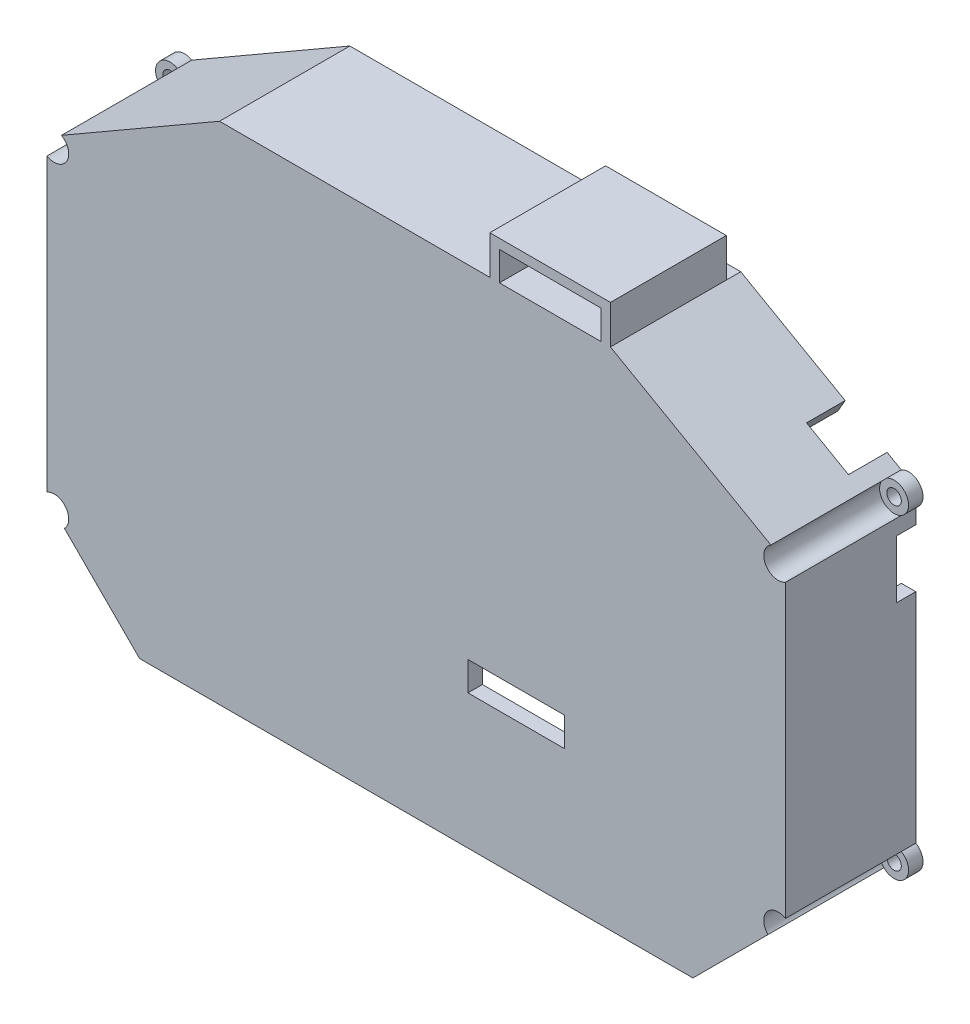
from build123d import *

# Parameters (mm, degrees)
SKETCH_2_R          = 1.5
EXTRUDE_1_DEPTH     = 27
SHELL_1_DEPTH       = 24
CUT_EXTRUDE_START   = -24
SKETCH_3_R          = 3
CUT_EXTRUDE_1_DEPTH = 24
SKETCH_5_W          = 20
SKETCH_5_H          = 6
CUT_EXTRUDE_3_DEPTH = 32
SKETCH_6_W          = 4
SKETCH_6_H          = 12
CUT_EXTRUDE_4_DEPTH = 32
SKETCH_7_W          = 10
SKETCH_7_H          = 8
CUT_EXTRUDE_5_DEPTH = 32
EXTRUDE_2_DEPTH     = 24
SKETCH_9_W          = 10
SKETCH_9_H          = 3
CUT_EXTRUDE_6_DEPTH = 24
SKETCH_10_R         = 1.35
CUT_EXTRUDE_7_DEPTH = 10
CUT_EXTRUDE_8_DEPTH = 10


# Read off the part's stored shape, not the designer's step: 抽壳1
with BuildPart() as part:
    # 草图2 → 凸台-拉伸1 (new body)
    with BuildSketch(Plane.XY):
        with BuildLine():
            Line((-76.5, 30.151923789), (-76.5, -30.151923789))
            ThreePointArc((-76.5, -30.151923789), (-77.380060021, -34.576284287), (-72.878679656, -34.871320344))
            Line((-72.878679656, -34.871320344), (-57.32, -50.43))
            Line((-57.32, -50.43), (57.32, -50.43))
            Line((57.32, -50.43), (72.878679656, -34.871320344))
            ThreePointArc((72.878679656, -34.871320344), (77.380060021, -34.576284287), (76.5, -30.151923789))
            Line((76.5, -30.151923789), (76.5, 30.151923789))
            ThreePointArc((76.5, 30.151923789), (77.593259199, 34.258312544), (73.483390382, 35.33841559))
            Line((73.483390382, 35.33841559), (40.238526366, 54.25))
            Line((40.238526366, 54.25), (-40.760907637, 54.25))
            Line((-40.760907637, 54.25), (-73.5, 35.348076211))
            ThreePointArc((-73.5, 35.348076211), (-77.598076211, 34.25), (-76.5, 30.151923789))
        make_face()
        with Locations((-75, 32.75)):
            Circle(SKETCH_2_R, mode=Mode.SUBTRACT)
        with Locations((75, 32.75)):
            Circle(SKETCH_2_R, mode=Mode.SUBTRACT)
        with Locations((75, -32.75)):
            Circle(SKETCH_2_R, mode=Mode.SUBTRACT)
        with Locations((-75, -32.75)):
            Circle(SKETCH_2_R, mode=Mode.SUBTRACT)
    extrude(amount=EXTRUDE_1_DEPTH)

    # 抽壳1 outline → 抽壳1 (cut)
    with BuildSketch(Plane.XY):
        with BuildLine():
            Line((-73.5, 28.507359313), (-73.5, -28.507359313))
            ThreePointArc((-73.5, -28.507359313), (-71.254879923, -30.255190266), (-70.506971411, -33.000387902))
            Line((-70.506971411, -33.000387902), (-56.077359313, -47.43))
            Line((-56.077359313, -47.43), (56.077359313, -47.43))
            Line((56.077359313, -47.43), (70.506971411, -33.000387902))
            ThreePointArc((70.506971411, -33.000387902), (71.254879923, -30.255190266), (73.5, -28.507359313))
            Line((73.5, -28.507359313), (73.5, 28.507359313))
            ThreePointArc((73.5, 28.507359313), (71.110106029, 30.48754008), (70.570593139, 33.543948905))
            Line((70.570593139, 33.543948905), (39.444948236, 51.25))
            Line((39.444948236, 51.25), (-39.95706006, 51.25))
            Line((-39.95706006, 51.25), (-70.575765386, 33.572282238))
            ThreePointArc((-70.575765386, 33.572282238), (-71.102885683, 30.5), (-73.5, 28.507359313))
        make_face()
    extrude(amount=SHELL_1_DEPTH, mode=Mode.SUBTRACT)

    # 草图3 → 切除-拉伸1 (cut)
    with BuildSketch(Plane.XY.offset(27).offset(CUT_EXTRUDE_START)):
        with Locations((75, 32.75)):
            Circle(SKETCH_3_R)
        with Locations((75, -32.75)):
            Circle(SKETCH_3_R)
        with Locations((-75, -32.75)):
            Circle(SKETCH_3_R)
        with Locations((-75, 32.75)):
            Circle(SKETCH_3_R)
    extrude(amount=CUT_EXTRUDE_1_DEPTH, mode=Mode.SUBTRACT)

    # 草图5 → 切除-拉伸3 (cut)
    with BuildSketch(Plane.XY.offset(27)):
        with Locations((20.7074416, -19.577067137)):
            Rectangle(SKETCH_5_W, SKETCH_5_H)
    extrude(amount=-CUT_EXTRUDE_3_DEPTH, mode=Mode.SUBTRACT)

    # 草图6 → 切除-拉伸4 (cut)
    with BuildSketch(Plane(origin=(76.5, 0, 0), x_dir=(0, 0, -1), z_dir=(1, 0, 0))):
        with Locations((-2, 20.977362477)):
            Rectangle(SKETCH_6_W, SKETCH_6_H)
    extrude(amount=-CUT_EXTRUDE_4_DEPTH, mode=Mode.SUBTRACT)

    # 草图7 → 切除-拉伸5 (cut)
    with BuildSketch(Plane(origin=(33.153284591, 58.280491682, 0), x_dir=(0.8692042501767389, -0.4944532045347601, 0), z_dir=(0.4944532045347601, 0.8692042501767389, 0))):
        with Locations((38.03253292, -4)):
            Rectangle(SKETCH_7_W, SKETCH_7_H)
    extrude(amount=-CUT_EXTRUDE_5_DEPTH, mode=Mode.SUBTRACT)

    # 草图8 → 凸台-拉伸2 (add)
    with BuildSketch(Plane.XY.offset(27)):
        Polygon((40.238526366, 54.25), (40.238526366, 62.25), (15.238526366, 62.25), (15.238526366, 54.25), (17.238526366, 54.25), (17.238526366, 60.25), (38.238526366, 60.25), (38.238526366, 54.25), align=None)
    extrude(amount=-EXTRUDE_2_DEPTH)

    # 草图9 → 切除-拉伸6 (cut)
    with BuildSketch(Plane(origin=(0, 54.25, 0), x_dir=(1, 0, 0), z_dir=(0, 1, 0))):
        with Locations((27.738526366, -1.5)):
            Rectangle(SKETCH_9_W, SKETCH_9_H)
    extrude(amount=-CUT_EXTRUDE_6_DEPTH, mode=Mode.SUBTRACT)

    # 草图10 → 切除-拉伸7 (cut)
    with BuildSketch(Plane.XZ.offset(50.43)):
        with Locations((-18.75, 20)):
            Circle(SKETCH_10_R)
        with Locations((18.75, 20)):
            Circle(SKETCH_10_R)
    extrude(amount=-CUT_EXTRUDE_7_DEPTH, mode=Mode.SUBTRACT)

    # 草图11 → 切除-拉伸8 (cut)
    with BuildSketch(Plane.XZ.offset(50.43)):
        Polygon((0, 3), (2, 3), (2, 0), (-2, 0), (-2, 3), align=None)
    extrude(amount=-CUT_EXTRUDE_8_DEPTH, mode=Mode.SUBTRACT)


solid = part.part
